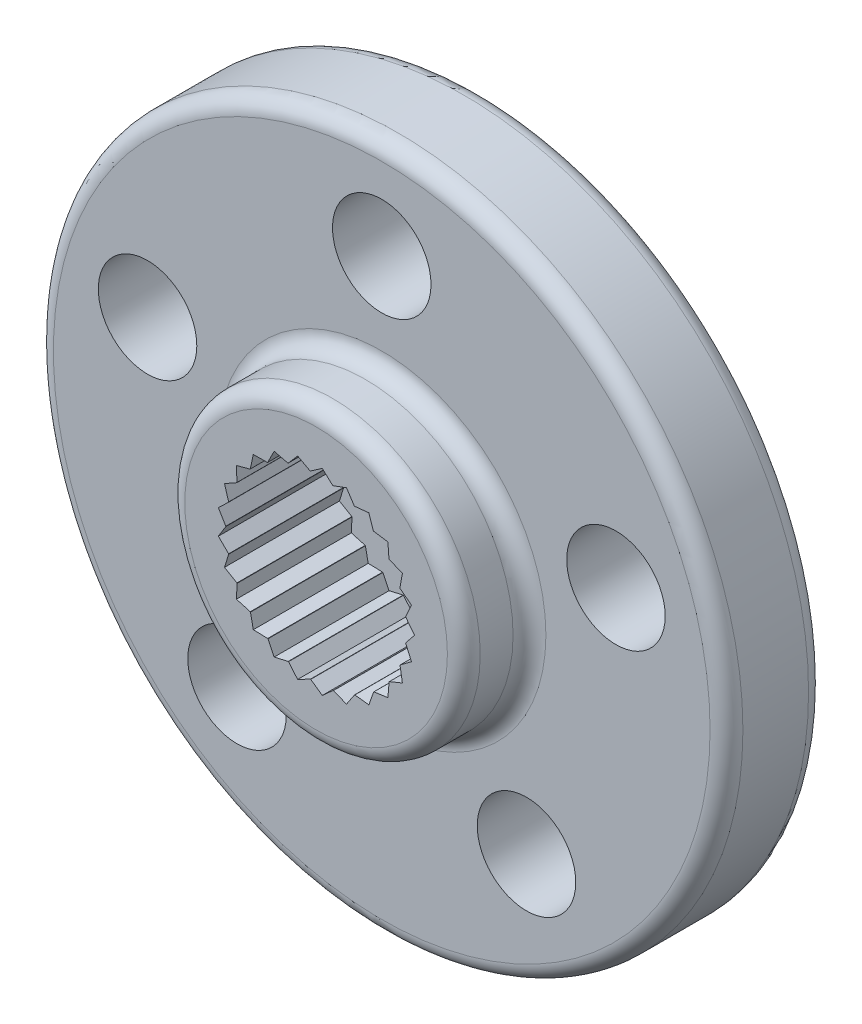
from build123d import *

# Parameters (mm, degrees)
SKETCH1_R           = 10.5
SKETCH1_R_2         = 4.5
SKETCH1_R_3         = 1.5
BOSS_EXTRUDE1_DEPTH = 3
SKETCH1_2_R         = 4.5
BOSS_EXTRUDE2_DEPTH = 5
SKETCH2_R           = 1.5
CUT_EXTRUDE1_DEPTH  = 4.5
SKETCH3_R           = 2.75
CUT_EXTRUDE2_DEPTH  = 3.5
CUT_EXTRUDE3_DEPTH  = 3.5
CIRPATTERN1_COUNT   = 25
BOSS_EXTRUDE3_START = 1
SKETCH5_R           = 4.5
SKETCH5_R_2         = 2.5
BOSS_EXTRUDE3_DEPTH = 1
FILLET1_R           = 0.5
FILLET2_R           = 0.5


with BuildPart() as part:
    # Sketch1 → Boss-Extrude1 (new body)
    with BuildSketch(Plane.XY):
        Circle(SKETCH1_R)
        Circle(SKETCH1_R_2, mode=Mode.SUBTRACT)
        with Locations((0, 7.5)):
            Circle(SKETCH1_R_3, mode=Mode.SUBTRACT)
        with Locations((7.132923872, 2.317627458)):
            Circle(SKETCH1_R_3, mode=Mode.SUBTRACT)
        with Locations((4.408389392, -6.067627458)):
            Circle(SKETCH1_R_3, mode=Mode.SUBTRACT)
        with Locations((-4.408389392, -6.067627458)):
            Circle(SKETCH1_R_3, mode=Mode.SUBTRACT)
        with Locations((-7.132923872, 2.317627458)):
            Circle(SKETCH1_R_3, mode=Mode.SUBTRACT)
    extrude(amount=BOSS_EXTRUDE1_DEPTH)

    # Sketch1<2> → Boss-Extrude2 (add)
    with BuildSketch(Plane.XY):
        Circle(SKETCH1_2_R)
    extrude(amount=BOSS_EXTRUDE2_DEPTH)

    # Sketch2 → Cut-Extrude1 (cut)
    with BuildSketch(Plane(origin=(0, 0, 0), x_dir=(-1, 0, 0), z_dir=(0, 0, -1))):
        Circle(SKETCH2_R)
    extrude(amount=-CUT_EXTRUDE1_DEPTH, mode=Mode.SUBTRACT)

    # Sketch3 → Cut-Extrude2 (cut)
    with BuildSketch(Plane.XY.offset(5)):
        Circle(SKETCH3_R)
    extrude(amount=-CUT_EXTRUDE2_DEPTH, mode=Mode.SUBTRACT)

    # Sketch4 → Cut-Extrude3 (cut)
    with BuildSketch(Plane.XY.offset(5)):
        with BuildLine():
            Line((-2.976344104, 0.375999701), (-2.75, 0))
            ThreePointArc((-2.75, 0), (-2.728912829, 0.339904061), (-2.665974712, 0.674595311))
            Line((-2.665974712, 0.674595311), (-2.976344104, 0.375999701))
        make_face()
    cut_extrude3 = extrude(amount=-CUT_EXTRUDE3_DEPTH, mode=Mode.SUBTRACT)

    # CirPattern1: Cut-Extrude3 ×25 about axis
    cirpattern1_axis = Axis((0, 0, 4.5), (0, 0, -1))
    for i in range(1, CIRPATTERN1_COUNT):
        add(cut_extrude3.rotate(cirpattern1_axis, i * 360 / CIRPATTERN1_COUNT), mode=Mode.SUBTRACT)

    # Sketch5 → Boss-Extrude3 (add)
    with BuildSketch(Plane(origin=(0, 0, 0), x_dir=(-1, 0, 0), z_dir=(0, 0, -1)).offset(BOSS_EXTRUDE3_START)):
        Circle(SKETCH5_R)
        Circle(SKETCH5_R_2, mode=Mode.SUBTRACT)
    extrude(amount=-BOSS_EXTRUDE3_DEPTH)

    # Fillet1
    fillet1_edges = [part.edges().sort_by_distance(p)[0] for p in [
        (4.5, 0, -1),
    ]]
    fillet(fillet1_edges, radius=FILLET1_R)

    # Fillet2
    fillet2_edges = [part.edges().sort_by_distance(p)[0] for p in [
        (-4.5, 0, 5),
        (-10.5, 0, 3),
        (-10.5, 0, 0),
        (-4.5, 0, 3),
    ]]
    fillet(fillet2_edges, radius=FILLET2_R)


solid = part.part
